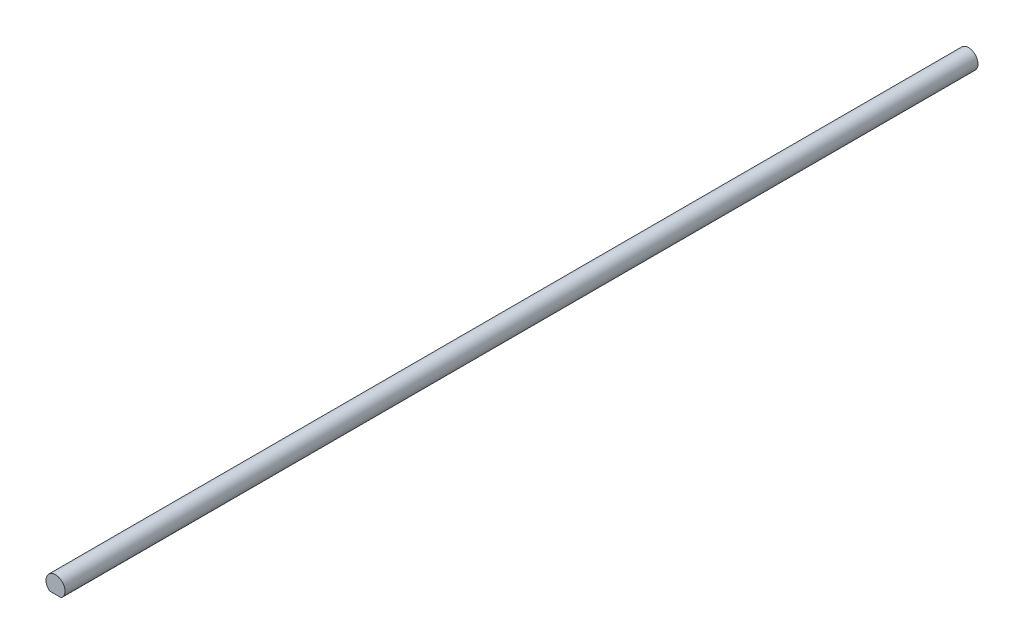
from build123d import *

# Parameters (mm, degrees)
BOSS_EXTRUDE1_DEPTH      = 152.4
BOSS_EXTRUDE1_DEPTH_BACK = 152.4


with BuildPart() as part:
    # Sketch1 → Boss-Extrude1 (new, two sides: drawn at the far end of the back side and taken through both)
    with BuildSketch(Plane.XY.offset(-BOSS_EXTRUDE1_DEPTH_BACK)):
        with BuildLine():
            Line((-1.905, -2.54), (1.905, -2.54))
            ThreePointArc((1.905, -2.54), (0, 3.175), (-1.905, -2.54))
        make_face()
    extrude(amount=BOSS_EXTRUDE1_DEPTH + BOSS_EXTRUDE1_DEPTH_BACK)


solid = part.part
